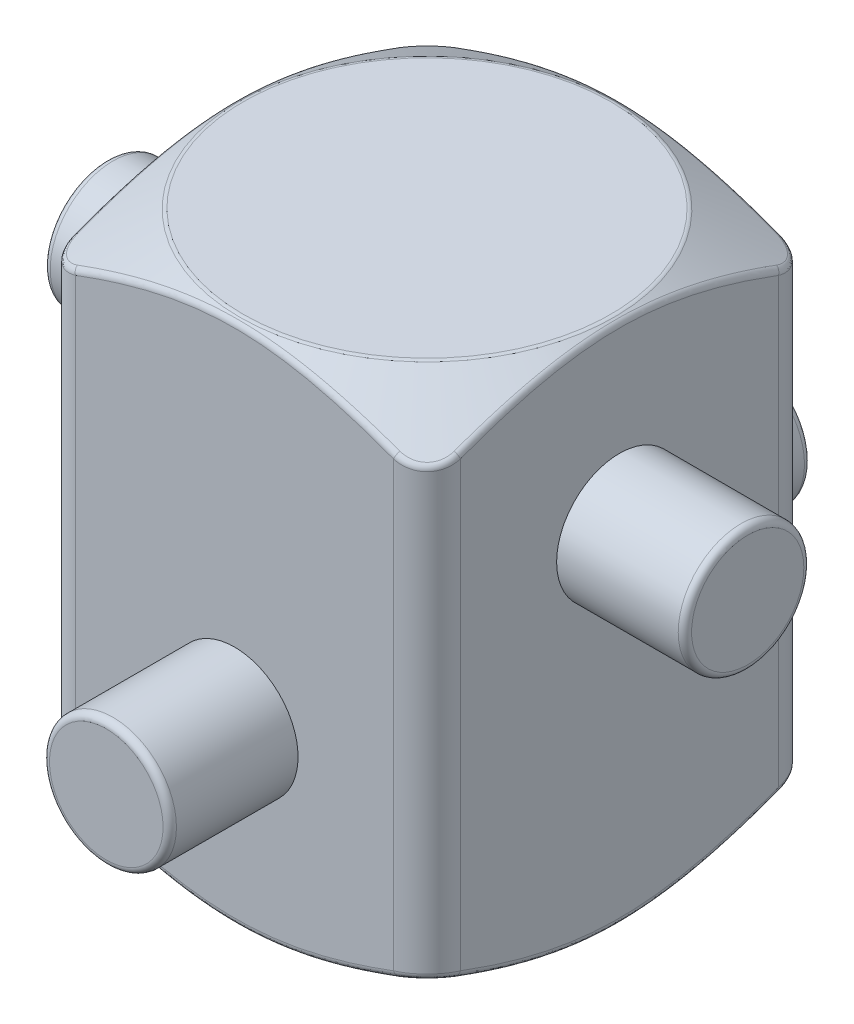
from build123d import *

# Parameters (mm, degrees)
SKETCH1_W           = 14.4
SKETCH1_H           = 14.4
BOSS_EXTRUDE1_DEPTH = 19.7
SKETCH4_R           = 2.375
BOSS_EXTRUDE3_DEPTH = 12
SKETCH5_R           = 2.35
BOSS_EXTRUDE4_DEPTH = 12
FILLET1_R           = 1.25
FILLET2_R           = 0.25


with BuildPart() as part:
    # Sketch1 → Boss-Extrude1 (new body)
    with BuildSketch(Plane(origin=(0, 0, 0), x_dir=(1, 0, 0), z_dir=(0, 1, 0))):
        Rectangle(SKETCH1_W, SKETCH1_H)
    extrude(amount=BOSS_EXTRUDE1_DEPTH)

    # Sketch2 → Cut-Revolve1 (revolve, cut)
    with BuildSketch(Plane.XY):
        Polygon((-7.2, 19.7), (-6.95, 19.7), (-13.3, 16.033825791), (-13.3, 3.666174209), (-6.95, 0), (-15.84, 0), (-15.84, 19.7), align=None)
    revolve(axis=Axis((0, 33.044922749, 0), (0, -1, 0)), mode=Mode.SUBTRACT)

    # Sketch4 → Boss-Extrude3 (add, symmetric)
    with BuildSketch(Plane.XY):
        with Locations((0, 6.7)):
            Circle(SKETCH4_R)
    extrude(amount=BOSS_EXTRUDE3_DEPTH, both=True)

    # Sketch5 → Boss-Extrude4 (add, symmetric)
    with BuildSketch(Plane(origin=(0, 0, 0), x_dir=(0, 0, -1), z_dir=(1, 0, 0))):
        with Locations((0, 13)):
            Circle(SKETCH5_R)
    extrude(amount=BOSS_EXTRUDE4_DEPTH, both=True)

    # Fillet1
    fillet1_edges = [part.edges().sort_by_distance(p)[0] for p in [
        (7.2, 9.85, -7.2),
        (-7.2, 9.85, -7.2),
        (-7.2, 9.85, 7.2),
        (7.2, 9.85, 7.2),
    ]]
    fillet(fillet1_edges, radius=FILLET1_R)

    # Fillet2
    fillet2_edges = [part.edges().sort_by_distance(p)[0] for p in [
        (6.833883478, 1.567258122, 6.833883475),
        (0, 0.144337567, 7.2),
        (-6.833883478, 1.567258122, 6.833883475),
        (-7.2, 0.496990622, -3.028002619),
        (-6.833883475, 1.567258122, -6.833883478),
        (0, 0.144337567, -7.2),
        (6.833883475, 1.567258122, -6.833883478),
        (0, 19.555662433, -7.2),
        (6.833883475, 18.132741878, -6.833883478),
        (7.2, 19.555662433, 0),
        (6.833883478, 18.132741878, 6.833883475),
        (0, 19.555662433, 7.2),
        (-6.833883478, 18.132741878, 6.833883475),
        (-7.2, 19.203009378, -3.028002619),
        (6.95, 19.7, 0),
        (7.2, 0.144337567, 0),
        (6.95, 0, 0),
        (-6.833883475, 18.132741878, -6.833883478),
        (12, 13, 2.35),
        (-2.375, 6.7, 12),
        (-2.375, 6.7, -12),
        (-12, 13, 2.35),
    ]]
    fillet(fillet2_edges, radius=FILLET2_R)


solid = part.part
